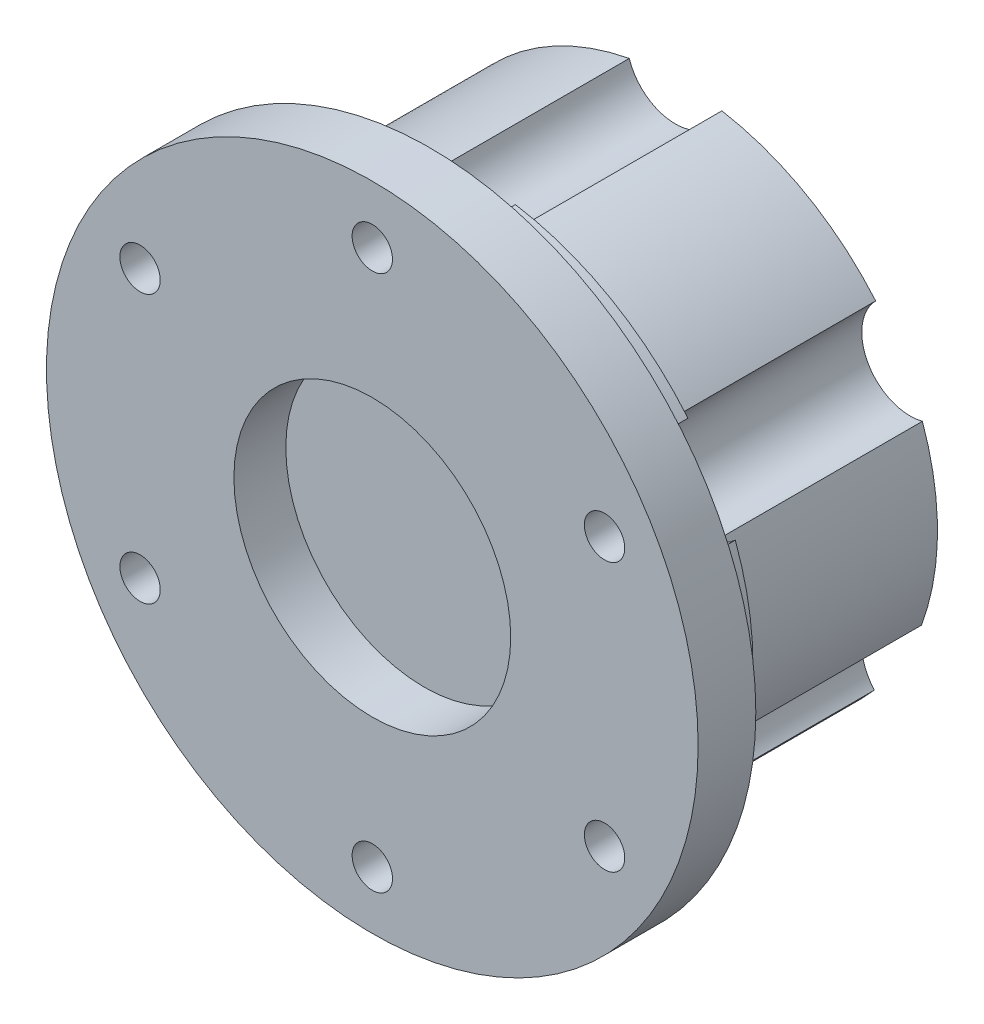
from build123d import *

# Parameters (mm, degrees)
SKETCH2_R                                     = 1.75
CUT_EXTRUDE1_DEPTH                            = 46.369317826
CIRPATTERN1_COUNT                             = 6
SKETCH5_OUTSIDE_W                             = 75.336
SKETCH5_OUTSIDE_H                             = 75.336
SKETCH5_OUTSIDE_R                             = 1.75
CUT_EXTRUDE2_DEPTH                            = 10
CIRPATTERN2_COUNT                             = 6
SKETCH6_R                                     = 12
CUT_EXTRUDE3_DEPTH                            = 4.5
CBORE_FOR_M3_HEX_HEAD_MACHINE_SCREW1_AT_COUNT = 2
CBORE_FOR_M3_HEX_HEAD_MACHINE_SCREW1_AT_PITCH = 23.25
CBORE_FOR_M3_HEX_HEAD_MACHINE_SCREW1_2_COUNT  = 2
CBORE_FOR_M3_HEX_HEAD_MACHINE_SCREW1_2_PITCH  = 40.270181276
CBORE_FOR_M3_HEX_HEAD_MACHINE_SCREW1_3_COUNT  = 2
CBORE_FOR_M3_HEX_HEAD_MACHINE_SCREW1_3_PITCH  = 46.5
CBORE_FOR_M3_HEX_HEAD_MACHINE_SCREW1_4_COUNT  = 2
CBORE_FOR_M3_HEX_HEAD_MACHINE_SCREW1_4_PITCH  = 40.270181276
CBORE_FOR_M3_HEX_HEAD_MACHINE_SCREW1_5_COUNT  = 2
CBORE_FOR_M3_HEX_HEAD_MACHINE_SCREW1_5_PITCH  = 23.25
SKETCH9_R                                     = 4.2
CUT_EXTRUDE4_DEPTH                            = 46.369317826
CIRPATTERN3_START                             = -26.5
CIRPATTERN3_DEPTH                             = 21.5


# Read off the part's stored shape, not the designer's step: CirPattern3
with BuildPart() as part:
    # Sketch1 → Revolve1 (revolve)
    with BuildSketch(Plane(origin=(0, 0, 0), x_dir=(0, 0, -1), z_dir=(1, 0, 0)), mode=Mode.PRIVATE) as revolve1_sk:
        Polygon((0, 0), (0, 28.25), (5, 28.25), (5, 24.5), (8.5, 24.5), (8.5, 22.5), (26.5, 22.5), (26.5, 0), align=None)
    revolve(revolve1_sk.sketch.rotate(Axis((0, 0, 0), (0, 0, -1)), 90), axis=Axis((0, 0, 0), (0, 0, -1)))

    # Sketch2 → Cut-Extrude1 (cut, symmetric)
    with BuildSketch(Plane(origin=(0, 0, -5), x_dir=(-1, 0, 0), z_dir=(0, 0, -1))):
        with Locations((0, 23.25)):
            Circle(SKETCH2_R)
    cut_extrude1 = extrude(amount=CUT_EXTRUDE1_DEPTH, both=True, mode=Mode.SUBTRACT)

    # CirPattern1: Cut-Extrude1 ×6 about axis
    cirpattern1_axis = Axis((0, 0, 0), (0, 0, 1))
    for i in range(1, CIRPATTERN1_COUNT):
        add(cut_extrude1.rotate(cirpattern1_axis, i * 360 / CIRPATTERN1_COUNT), mode=Mode.SUBTRACT)

    # Sketch5 outside → Cut-Extrude2 (cut)
    # profile 1 of 2: a face of its own
    with BuildSketch(Plane(origin=(0, 0, -26.5), x_dir=(-1, 0, 0), z_dir=(0, 0, -1))):
        Rectangle(SKETCH5_OUTSIDE_W, SKETCH5_OUTSIDE_H)
        with BuildLine():
            ThreePointArc((-1.554498096, 22.446236559), (-11.25, 19.485571585), (-18.661762031, 12.569353121))
            ThreePointArc((-18.661762031, 12.569353121), (-18.619546181, 10.75), (-20.216260128, 9.876883438))
            ThreePointArc((-20.216260128, 9.876883438), (-22.5, 0), (-20.216260128, -9.876883438))
            ThreePointArc((-20.216260128, -9.876883438), (-18.619546181, -10.75), (-18.661762031, -12.569353121))
            ThreePointArc((-18.661762031, -12.569353121), (-11.25, -19.485571585), (-1.554498096, -22.446236559))
            ThreePointArc((-1.554498096, -22.446236559), (0, -21.5), (1.554498096, -22.446236559))
            ThreePointArc((1.554498096, -22.446236559), (11.25, -19.485571585), (18.661762031, -12.569353121))
            ThreePointArc((18.661762031, -12.569353121), (18.619546181, -10.75), (20.216260128, -9.876883438))
            ThreePointArc((20.216260128, -9.876883438), (22.5, 0), (20.216260128, 9.876883438))
            ThreePointArc((20.216260128, 9.876883438), (18.619546181, 10.75), (18.661762031, 12.569353121))
            ThreePointArc((18.661762031, 12.569353121), (11.25, 19.485571585), (1.554498096, 22.446236559))
            ThreePointArc((1.554498096, 22.446236559), (0, 21.5), (-1.554498096, 22.446236559))
        make_face(mode=Mode.SUBTRACT)
    # profile 2 of 2: a face of its own
    with BuildSketch(Plane(origin=(0, 0, -26.5), x_dir=(-1, 0, 0), z_dir=(0, 0, -1))):
        with Locations((8.25, 14.289419162)):
            Circle(SKETCH5_OUTSIDE_R)
    cut_extrude2 = extrude(amount=-CUT_EXTRUDE2_DEPTH, mode=Mode.SUBTRACT)

    # CirPattern2: Cut-Extrude2 ×6 about axis
    cirpattern2_axis = Axis((0, 0, 0), (0, 0, 1))
    for i in range(1, CIRPATTERN2_COUNT):
        add(cut_extrude2.rotate(cirpattern2_axis, i * 360 / CIRPATTERN2_COUNT), mode=Mode.SUBTRACT)

    # Sketch6 → Cut-Extrude3 (cut)
    with BuildSketch(Plane.XY):
        Circle(SKETCH6_R)
    extrude(amount=-CUT_EXTRUDE3_DEPTH, mode=Mode.SUBTRACT)

    # Sketch8 → CBORE for M3 Hex Head Machine Screw1 (revolve, cut)
    with BuildSketch(Plane(origin=(20.135090638, 11.625, -5), x_dir=(0, 1, 0), z_dir=(1, 0, 0))):
        Polygon((0, 0), (0, 5), (1.7, 5), (1.7, 2.3), (4.2, 2.3), (4.2, 0), align=None)
    cbore_for_m3_hex_head_machine_screw1 = revolve(axis=Axis((20.135090638, 11.625, -11.35), (0, 0, 1)), mode=Mode.SUBTRACT)

    # CBORE for M3 Hex Head Machine Screw1 at: CBORE for M3 Hex Head Machine Screw1 ×2
    with Locations(*[Vector(-0.8660254037844417, 0.49999999999999484, 0) * (i * CBORE_FOR_M3_HEX_HEAD_MACHINE_SCREW1_AT_PITCH) for i in range(1, CBORE_FOR_M3_HEX_HEAD_MACHINE_SCREW1_AT_COUNT)]):
        add(cbore_for_m3_hex_head_machine_screw1, mode=Mode.SUBTRACT)

    # CBORE for M3 Hex Head Machine Screw1 2: CBORE for M3 Hex Head Machine Screw1 ×2
    with Locations(*[(-i * CBORE_FOR_M3_HEX_HEAD_MACHINE_SCREW1_2_PITCH, 0, 0) for i in range(1, CBORE_FOR_M3_HEX_HEAD_MACHINE_SCREW1_2_COUNT)]):
        add(cbore_for_m3_hex_head_machine_screw1, mode=Mode.SUBTRACT)

    # CBORE for M3 Hex Head Machine Screw1 3: CBORE for M3 Hex Head Machine Screw1 ×2
    with Locations(*[Vector(-0.8660254037844346, -0.5000000000000071, 0) * (i * CBORE_FOR_M3_HEX_HEAD_MACHINE_SCREW1_3_PITCH) for i in range(1, CBORE_FOR_M3_HEX_HEAD_MACHINE_SCREW1_3_COUNT)]):
        add(cbore_for_m3_hex_head_machine_screw1, mode=Mode.SUBTRACT)

    # CBORE for M3 Hex Head Machine Screw1 4: CBORE for M3 Hex Head Machine Screw1 ×2
    with Locations(*[Vector(-0.49999999999999495, -0.8660254037844416, 0) * (i * CBORE_FOR_M3_HEX_HEAD_MACHINE_SCREW1_4_PITCH) for i in range(1, CBORE_FOR_M3_HEX_HEAD_MACHINE_SCREW1_4_COUNT)]):
        add(cbore_for_m3_hex_head_machine_screw1, mode=Mode.SUBTRACT)

    # CBORE for M3 Hex Head Machine Screw1 5: CBORE for M3 Hex Head Machine Screw1 ×2
    with Locations(*[(0, -i * CBORE_FOR_M3_HEX_HEAD_MACHINE_SCREW1_5_PITCH, 0) for i in range(1, CBORE_FOR_M3_HEX_HEAD_MACHINE_SCREW1_5_COUNT)]):
        add(cbore_for_m3_hex_head_machine_screw1, mode=Mode.SUBTRACT)

    # Sketch9 → Cut-Extrude4 (cut, through all)
    with BuildSketch(Plane(origin=(0, 0, -5), x_dir=(-1, 0, 0), z_dir=(0, 0, -1))):
        with Locations((-20.135090638, 11.625)):
            Circle(SKETCH9_R)
    extrude(amount=CUT_EXTRUDE4_DEPTH, mode=Mode.SUBTRACT)

    # CirPattern3 outline → CirPattern3 (cut)
    with BuildSketch(Plane.XY.offset(CIRPATTERN3_START)):
        with BuildLine():
            ThreePointArc((-1.256823209, 24.467741935), (-2.811398825, 24.338160091), (-4.35457664, 24.109907969))
            ThreePointArc((-4.35457664, 24.109907969), (-0.179741778, 19.176685596), (3.901890218, 24.187295275))
            ThreePointArc((3.901890218, 24.187295275), (2.58316543, 24.363440979), (1.256823209, 24.467741935))
            ThreePointArc((1.256823209, 24.467741935), (0, 21.5), (-1.256823209, 24.467741935))
        make_face()
        with BuildLine():
            ThreePointArc((-18.968503996, 15.506316654), (-19.795032609, 14.436297449), (-20.561274485, 13.322311795))
            ThreePointArc((-20.561274485, 13.322311795), (-18.619546181, 10.75), (-21.818097694, 11.145430141))
            ThreePointArc((-21.818097694, 11.145430141), (-22.490778714, 9.716731593), (-23.070024017, 8.247665844))
            ThreePointArc((-23.070024017, 8.247665844), (-16.916681459, 9.558816026), (-18.968503996, 15.506316654))
        make_face()
        with BuildLine():
            ThreePointArc((-21.818097694, -11.145430141), (-18.619546181, -10.75), (-20.561274485, -13.322311795))
            ThreePointArc((-20.561274485, -13.322311795), (-19.723759912, -14.533523143), (-18.81499127, -15.692230674))
            ThreePointArc((-18.81499127, -15.692230674), (-16.935996673, -9.778002238), (-22.997366041, -8.448145074))
            ThreePointArc((-22.997366041, -8.448145074), (-22.448280204, -9.814515571), (-21.818097694, -11.145430141))
        make_face()
        with BuildLine():
            ThreePointArc((-1.256823209, -24.467741935), (0, -21.5), (1.256823209, -24.467741935))
            ThreePointArc((1.256823209, -24.467741935), (2.604684023, -24.361149832), (3.944612144, -24.180364659))
            ThreePointArc((3.944612144, -24.180364659), (-0.18016322, -19.429683905), (-4.392323866, -24.103059786))
            ThreePointArc((-4.392323866, -24.103059786), (-2.830452956, -24.335951513), (-1.256823209, -24.467741935))
        make_face()
        with BuildLine():
            ThreePointArc((20.561274485, -13.322311795), (18.619546181, -10.75), (21.818097694, -11.145430141))
            ThreePointArc((21.818097694, -11.145430141), (22.390941527, -9.944633606), (22.897757266, -8.714511586))
            ThreePointArc((22.897757266, -8.714511586), (16.517625997, -9.744003743), (18.702504464, -15.826127977))
            ThreePointArc((18.702504464, -15.826127977), (19.671765509, -14.603822849), (20.561274485, -13.322311795))
        make_face()
    extrude(amount=CIRPATTERN3_DEPTH, mode=Mode.SUBTRACT)


solid = part.part
